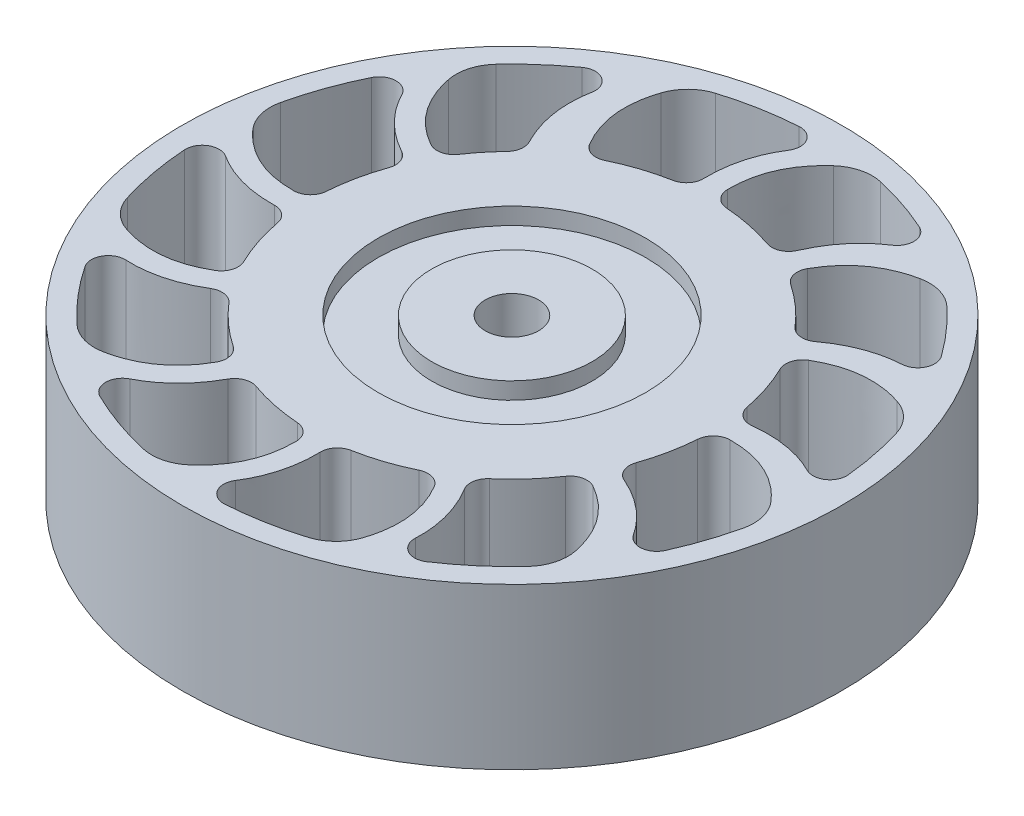
from build123d import *

# Parameters (mm, degrees)
SKETCH1_R               = 38.1
BOSS_EXTRUDE1_DEPTH     = 19.05
CUT_EXTRUDE2_START      = -19.05
CUT_EXTRUDE2_DEPTH      = 19.05
SKETCH3_R               = 15.875
CUT_EXTRUDE3_DEPTH      = 2
SKETCH5_R               = 9.525
BOSS_EXTRUDE3_DEPTH     = 2
CUT_EXTRUDE4_DEPTH      = 57.514799112
CUT_EXTRUDE4_DEPTH_BACK = 57.514799112
SKETCH4_R               = 3.175
FILLET4_R               = 2
FILLET5_R               = 5
FILLET6_R               = 2
BOSS_EXTRUDE4_START     = -19.05
SKETCH6_R               = 39.1
SKETCH6_R_2             = 38.1
BOSS_EXTRUDE4_DEPTH     = 19.05


# Read off the part's stored shape, not the designer's step: Cut-Extrude2
with BuildPart() as part:
    # Sketch1 → Boss-Extrude1 (new body)
    with BuildSketch(Plane(origin=(0, 0, 0), x_dir=(1, 0, 0), z_dir=(0, 1, 0))):
        with Locations(Location((0, 0, 0), (0, 0, 90))):
            Circle(SKETCH1_R)
    extrude(amount=BOSS_EXTRUDE1_DEPTH)

    # Cut-Extrude2 outline → Cut-Extrude2 (cut)
    with BuildSketch(Plane(origin=(0, 19.05, 0), x_dir=(1, 0, 0), z_dir=(0, 1, 0)).offset(CUT_EXTRUDE2_START)):
        with BuildLine():
            add(Edge.make_bspline(
                [(0, 23.8123984), (-1.075812839, 31.702653016), (5.841806996, 36.042141269)],
                knots=[0, 0, 0, 1, 1, 1], degree=2))
            ThreePointArc((0, 23.8123984), (4.913662968, 23.29991918), (9.615826857, 21.784540193))
            add(Edge.make_bspline(
                [(9.615826857, 21.784540193), (9.623255506, 21.808690438), (10.592185669, 24.995195487), (13.956641089, 28.936941957), (17.033685387, 30.787490245), (18.567444035, 31.328350977), (18.686650213, 31.368324151)],
                knots=[0.011508736, 0.011508736, 0.011508736, 0.014280778, 0.375, 0.625, 0.796938924, 0.811294154, 0.811294154, 0.811294154], degree=2))
            ThreePointArc((18.686650213, 31.368324151), (12.484888661, 34.311662906), (5.841806996, 36.042141269))
        make_face()
        with BuildLine():
            add(Edge.make_bspline(
                [(-11.9061992, 20.622141939), (-16.783007756, 26.917396459), (-12.961917372, 34.134313444)],
                knots=[0, 0, 0, 1, 1, 1], degree=2))
            ThreePointArc((-11.9061992, 20.622141939), (-7.38459867, 22.638419115), (-2.543794181, 23.676136271))
            add(Edge.make_bspline(
                [(-2.543794181, 23.676136271), (-2.976792153, 26.981363878), (-1.522032634, 31.980241297), (0.726265503, 35.214338774), (2.132707698, 36.450160687)],
                knots=[0.011351369, 0.011351369, 0.011351369, 0.375, 0.625, 0.837737706, 0.837737706, 0.837737706], degree=2))
            ThreePointArc((2.132707698, 36.450160687), (-5.537032838, 36.090219223), (-12.961917372, 34.134313444))
        make_face()
        with BuildLine():
            add(Edge.make_bspline(
                [(-23.8123984, 0), (-31.702653016, -1.075812839), (-36.042141269, 5.841806996)],
                knots=[0, 0, 0, 1, 1, 1], degree=2))
            ThreePointArc((-23.8123984, 0), (-23.307562388, 4.877279272), (-21.814459957, 9.547756509))
            add(Edge.make_bspline(
                [(-21.814459957, 9.547756509), (-21.818441952, 9.549476554), (-21.869919654, 9.571802694), (-24.959060295, 10.887109515), (-28.517653025, 14.654514894), (-30.027877457, 17.912114123), (-30.45133716, 19.707094731), (-30.516621915, 20.047404898)],
                knots=[0.008090523, 0.008090523, 0.008090523, 0.008568467, 0.014280778, 0.375, 0.625, 0.796938924, 0.836257242, 0.836257242, 0.836257242], degree=2))
            ThreePointArc((-30.516621915, 20.047404898), (-34.02891406, 13.236149899), (-36.042141269, 5.841806996))
        make_face()
        with BuildLine():
            add(Edge.make_bspline(
                [(-20.622141939, 11.9061992), (-27.993209298, 14.91964526), (-28.292506448, 23.080223897)],
                knots=[0, 0, 0, 1, 1, 1], degree=2))
            ThreePointArc((-20.622141939, 11.9061992), (-18.558828274, 14.91979258), (-16.058930608, 17.582407836))
            add(Edge.make_bspline(
                [(-16.058930608, 17.582407836), (-17.476169208, 19.77857686), (-18.541164692, 24.260289613), (-18.220257801, 27.836565517), (-17.584209292, 29.9531527), (-16.915781052, 31.636309699), (-16.378101299, 32.633118976)],
                knots=[0.082142591, 0.082142591, 0.082142591, 0.375, 0.625, 0.796938924, 0.878163354, 1, 1, 1], degree=2))
            ThreePointArc((-16.378101299, 32.633118976), (-22.840320712, 28.486530256), (-28.292506448, 23.080223897))
        make_face()
        with BuildLine():
            add(Edge.make_bspline(
                [(23.8123984, 0), (31.702653016, 1.075812839), (36.042141269, -5.841806996)],
                knots=[0, 0, 0, 1, 1, 1], degree=2))
            ThreePointArc((23.8123984, 0), (23.29991918, -4.913662968), (21.784540193, -9.615826857))
            add(Edge.make_bspline(
                [(21.784540193, -9.615826857), (21.808690438, -9.623255506), (24.995195487, -10.592185669), (28.936941957, -13.956641089), (30.787490245, -17.033685387), (31.328350977, -18.567444035), (31.368324151, -18.686650213)],
                knots=[0.011508736, 0.011508736, 0.011508736, 0.014280778, 0.375, 0.625, 0.796938924, 0.811294154, 0.811294154, 0.811294154], degree=2))
            ThreePointArc((31.368324151, -18.686650213), (34.311662906, -12.484888661), (36.042141269, -5.841806996))
        make_face()
        with BuildLine():
            add(Edge.make_bspline(
                [(20.622141939, -11.9061992), (27.993209298, -14.91964526), (28.292506448, -23.080223897)],
                knots=[0, 0, 0, 1, 1, 1], degree=2))
            ThreePointArc((20.622141939, -11.9061992), (17.714459603, -15.91314672), (14.041058518, -19.232238384))
            add(Edge.make_bspline(
                [(14.041058518, -19.232238384), (14.056777328, -19.252985783), (16.077333879, -21.901594041), (17.310863971, -26.935015245), (17.015096041, -30.513457911), (16.493582567, -32.294212991), (16.378101299, -32.633118976)],
                knots=[0.011424622, 0.011424622, 0.011424622, 0.014280778, 0.375, 0.625, 0.796938924, 0.837551139, 0.837551139, 0.837551139], degree=2))
            ThreePointArc((16.378101299, -32.633118976), (22.840320712, -28.486530256), (28.292506448, -23.080223897))
        make_face()
        with BuildLine():
            add(Edge.make_bspline(
                [(11.9061992, 20.622141939), (14.91964526, 27.993209298), (23.080223897, 28.292506448)],
                knots=[0, 0, 0, 1, 1, 1], degree=2))
            ThreePointArc((11.9061992, 20.622141939), (15.905316546, 17.721490432), (19.219820433, 14.058051789))
            add(Edge.make_bspline(
                [(19.219820433, 14.058051789), (19.238328955, 14.075252189), (21.670699614, 16.35038143), (26.555276713, 18.081806299), (30.145349387, 18.145905978), (31.744053706, 17.847425787), (31.867275872, 17.822440482)],
                knots=[0.011508736, 0.011508736, 0.011508736, 0.014280778, 0.375, 0.625, 0.796938924, 0.811294154, 0.811294154, 0.811294154], degree=2))
            ThreePointArc((31.867275872, 17.822440482), (27.968062197, 23.472327392), (23.080223897, 28.292506448))
        make_face()
        with BuildLine():
            add(Edge.make_bspline(
                [(20.622141939, 11.9061992), (26.917396459, 16.783007756), (34.134313444, 12.961917372)],
                knots=[0, 0, 0, 1, 1, 1], degree=2))
            ThreePointArc((20.622141939, 11.9061992), (22.6351534, 7.394602634), (23.673878645, 2.56471976))
            add(Edge.make_bspline(
                [(23.673878645, 2.56471976), (23.698507696, 2.570361483), (26.942567099, 3.324495873), (32.038447387, 2.381665245), (35.179591364, 0.642140858), (36.414869822, -0.41570273), (36.509090696, -0.498951721)],
                knots=[0.011508736, 0.011508736, 0.011508736, 0.014280778, 0.375, 0.625, 0.796938924, 0.811294154, 0.811294154, 0.811294154], degree=2))
            ThreePointArc((36.509090696, -0.498951721), (35.957216053, 6.343600709), (34.134313444, 12.961917372))
        make_face()
        with BuildLine():
            add(Edge.make_bspline(
                [(-11.9061992, -20.622141939), (-14.91964526, -27.993209298), (-23.080223897, -28.292506448)],
                knots=[0, 0, 0, 1, 1, 1], degree=2))
            ThreePointArc((-11.9061992, -20.622141939), (-15.877628945, -17.746301492), (-19.175829664, -14.117998238))
            add(Edge.make_bspline(
                [(-19.175829664, -14.117998238), (-19.179310265, -14.120586724), (-19.22438412, -14.154004652), (-21.908043561, -16.171625513), (-26.950008691, -17.369754529), (-30.526284595, -17.048847638), (-32.292513251, -16.518084194), (-32.619872879, -16.404467367)],
                knots=[0.008090523, 0.008090523, 0.008090523, 0.008568467, 0.014280778, 0.375, 0.625, 0.796938924, 0.836257242, 0.836257242, 0.836257242], degree=2))
            ThreePointArc((-32.619872879, -16.404467367), (-28.477299091, -22.851829089), (-23.080223897, -28.292506448))
        make_face()
        with BuildLine():
            add(Edge.make_bspline(
                [(-20.622141939, -11.9061992), (-26.917396459, -16.783007756), (-34.134313444, -12.961917372)],
                knots=[0, 0, 0, 1, 1, 1], degree=2))
            ThreePointArc((-20.622141939, -11.9061992), (-22.623580764, -7.429933444), (-23.665754747, -2.638630293))
            add(Edge.make_bspline(
                [(-23.665754747, -2.638630293), (-23.670063278, -2.639131687), (-23.725807346, -2.645535534), (-27.058735027, -3.051016734), (-32.024269423, -1.567644334), (-34.960961762, 0.498407138), (-36.225178925, 1.841176092), (-36.451872265, 2.103250964)],
                knots=[0.008090523, 0.008090523, 0.008090523, 0.008568467, 0.014280778, 0.375, 0.625, 0.796938924, 0.836257242, 0.836257242, 0.836257242], degree=2))
            ThreePointArc((-36.451872265, 2.103250964), (-36.087978989, -5.551614969), (-34.134313444, -12.961917372))
        make_face()
        with BuildLine():
            add(Edge.make_bspline(
                [(11.9061992, -20.622141939), (16.783007756, -26.917396459), (12.961917372, -34.134313444)],
                knots=[0, 0, 0, 1, 1, 1], degree=2))
            ThreePointArc((11.9061992, -20.622141939), (7.38459867, -22.638419115), (2.543794181, -23.676136271))
            add(Edge.make_bspline(
                [(2.543794181, -23.676136271), (2.54703337, -23.701963451), (2.972582544, -27.006003762), (1.524140338, -31.981839439), (-0.521223536, -34.932977728), (-1.863244994, -36.214400129), (-2.132707698, -36.450160687)],
                knots=[0.011424622, 0.011424622, 0.011424622, 0.014280778, 0.375, 0.625, 0.796938924, 0.837551139, 0.837551139, 0.837551139], degree=2))
            ThreePointArc((-2.132707698, -36.450160687), (5.537032838, -36.090219223), (12.961917372, -34.134313444))
        make_face()
        with BuildLine():
            add(Edge.make_bspline(
                [(0, -23.8123984), (1.075812839, -31.702653016), (-5.841806996, -36.042141269)],
                knots=[0, 0, 0, 1, 1, 1], degree=2))
            ThreePointArc((0, -23.8123984), (-4.877279272, -23.307562388), (-9.547756509, -21.814459957))
            add(Edge.make_bspline(
                [(-9.547756509, -21.814459957), (-9.549476554, -21.818441952), (-9.571802694, -21.869919654), (-10.887109515, -24.959060295), (-14.654514894, -28.517653025), (-17.912114123, -30.027877457), (-19.707094731, -30.45133716), (-20.047404898, -30.516621915)],
                knots=[0.008090523, 0.008090523, 0.008090523, 0.008568467, 0.014280778, 0.375, 0.625, 0.796938924, 0.836257242, 0.836257242, 0.836257242], degree=2))
            ThreePointArc((-20.047404898, -30.516621915), (-13.236149899, -34.02891406), (-5.841806996, -36.042141269))
        make_face()
    extrude(amount=CUT_EXTRUDE2_DEPTH, mode=Mode.SUBTRACT)

    # Sketch3 → Cut-Extrude3 (cut)
    with BuildSketch(Plane(origin=(0, 19.05, 0), x_dir=(1, 0, 0), z_dir=(0, 1, 0))):
        with Locations(Location((0, 0, 0), (0, 0, 270))):
            Circle(SKETCH3_R)
    extrude(amount=-CUT_EXTRUDE3_DEPTH, mode=Mode.SUBTRACT)

    # Sketch5 → Boss-Extrude3 (add)
    with BuildSketch(Plane(origin=(0, 17.05, 0), x_dir=(1, 0, 0), z_dir=(0, 1, 0))):
        with Locations(Location((0, 0, 0), (0, 0, 270))):
            Circle(SKETCH5_R)
    extrude(amount=BOSS_EXTRUDE3_DEPTH)

    # Sketch4 → Cut-Extrude4 (cut, two sides: drawn at the far end of the back side and taken through both)
    with BuildSketch(Plane(origin=(0, 17.05, 0), x_dir=(1, 0, 0), z_dir=(0, 1, 0)).offset(-CUT_EXTRUDE4_DEPTH_BACK)):
        with Locations(Location((0, 0, 0), (0, 0, 270))):
            Circle(SKETCH4_R)
    extrude(amount=CUT_EXTRUDE4_DEPTH + CUT_EXTRUDE4_DEPTH_BACK, mode=Mode.SUBTRACT)

    # Fillet4
    fillet4_edges = [part.edges().sort_by_distance(p)[0] for p in [
        (-16.378101299, 9.525, -32.633118976),
        (-30.516621915, 9.525, -20.047404898),
        (2.132707698, 9.525, -36.450160687),
        (18.686650213, 9.525, -31.368324151),
        (-20.047404898, 9.525, 30.516621915),
        (-2.132707698, 9.525, 36.450160687),
        (-36.451872265, 9.525, -2.103250964),
        (-32.619872879, 9.525, 16.404467367),
        (36.509090696, 9.525, 0.498951721),
        (31.867275872, 9.525, -17.822440482),
        (16.378101299, 9.525, 32.633118976),
        (31.368324151, 9.525, 18.686650213),
    ]]
    fillet(fillet4_edges, radius=FILLET4_R)

    # Fillet5
    fillet5_edges = [part.edges().sort_by_distance(p)[0] for p in [
        (-28.292506448, 9.525, -23.080223897),
        (-36.042141269, 9.525, -5.841806996),
        (-12.961917372, 9.525, -34.134313444),
        (5.841806996, 9.525, -36.042141269),
        (-5.841806996, 9.525, 36.042141269),
        (12.961917372, 9.525, 34.134313444),
        (-34.134313444, 9.525, 12.961917372),
        (-23.080223897, 9.525, 28.292506448),
        (34.134313444, 9.525, -12.961917372),
        (23.080223897, 9.525, -28.292506448),
        (28.292506448, 9.525, 23.080223897),
        (36.042141269, 9.525, 5.841806996),
    ]]
    fillet(fillet5_edges, radius=FILLET5_R)

    # Fillet6
    fillet6_edges = [part.edges().sort_by_distance(p)[0] for p in [
        (9.615826857, 9.525, -21.784540193),
        (19.219820433, 9.525, -14.058051789),
        (23.673878645, 9.525, -2.56471976),
        (21.784540193, 9.525, 9.615826857),
        (14.041058518, 9.525, 19.232238384),
        (2.543794181, 9.525, 23.676136271),
        (-9.547756509, 9.525, 21.814459957),
        (-19.175829664, 9.525, 14.117998238),
        (-23.665754747, 9.525, 2.638630293),
        (-21.814459957, 9.525, -9.547756509),
        (-16.058930608, 9.525, -17.582407836),
        (-2.543794181, 9.525, -23.676136271),
        (11.9061992, 9.525, -20.622141939),
        (0, 9.525, -23.8123984),
        (-11.9061992, 9.525, -20.622141939),
        (-20.622141939, 9.525, -11.9061992),
        (-23.8123984, 9.525, 0),
        (-20.622141939, 9.525, 11.9061992),
        (-11.9061992, 9.525, 20.622141939),
        (0, 9.525, 23.8123984),
        (11.9061992, 9.525, 20.622141939),
        (20.622141939, 9.525, 11.9061992),
        (23.8123984, 9.525, 0),
        (20.622141939, 9.525, -11.9061992),
    ]]
    fillet(fillet6_edges, radius=FILLET6_R)

    # Sketch6 → Boss-Extrude4 (add)
    with BuildSketch(Plane(origin=(0, 19.05, 0), x_dir=(1, 0, 0), z_dir=(0, 1, 0)).offset(BOSS_EXTRUDE4_START)):
        with Locations(Location((0, 0, 0), (0, 0, 270))):
            Circle(SKETCH6_R)
        Circle(SKETCH6_R_2, mode=Mode.SUBTRACT)
    extrude(amount=BOSS_EXTRUDE4_DEPTH)


solid = part.part
